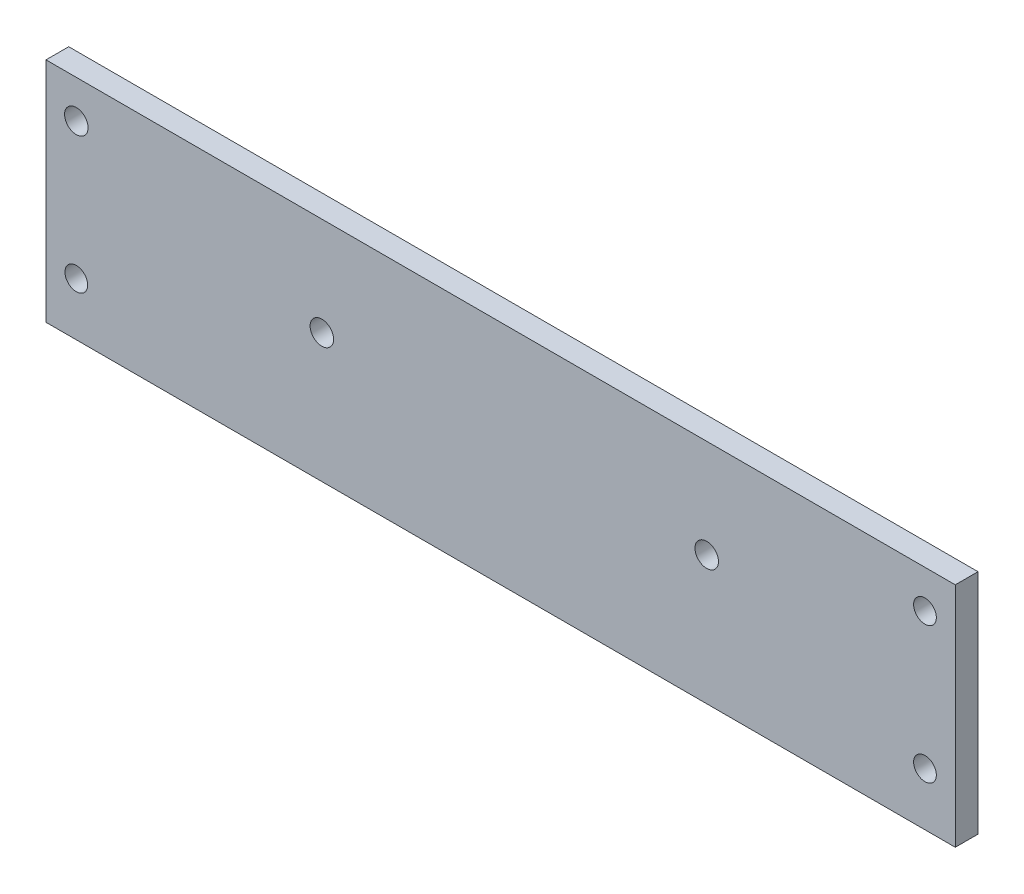
from build123d import *

# Parameters (mm, degrees)
SKETCH_1_W          = 120
SKETCH_1_H          = 30
EXTRUDE_1_DEPTH     = 3
SKETCH_3_R          = 1.5
SKETCH_3_R_2        = 1.55
CUT_EXTRUDE_2_DEPTH = 10
SKETCH_6_R          = 1.5
CUT_EXTRUDE_3_DEPTH = 10
SKETCH_8_R          = 1.55
CUT_EXTRUDE_4_DEPTH = 62.919302322


with BuildPart() as part:
    # 草图1 → 凸台-拉伸1 (new body)
    with BuildSketch(Plane.XY):
        Rectangle(SKETCH_1_W, SKETCH_1_H)
    extrude(amount=EXTRUDE_1_DEPTH)

    # 草图3 → 切除-拉伸2 (cut)
    with BuildSketch(Plane(origin=(0, 0, 0), x_dir=(-1, 0, 0), z_dir=(0, 0, -1))):
        with Locations((-56, 10)):
            Circle(SKETCH_3_R)
        with Locations((56, 10)):
            Circle(SKETCH_3_R_2)
    extrude(amount=-CUT_EXTRUDE_2_DEPTH, mode=Mode.SUBTRACT)

    # 草图6 → 切除-拉伸3 (cut)
    with BuildSketch(Plane.XY.offset(3)):
        with Locations((-56, -8)):
            Circle(SKETCH_6_R)
        with Locations((56, -8)):
            Circle(SKETCH_6_R)
    extrude(amount=-CUT_EXTRUDE_3_DEPTH, mode=Mode.SUBTRACT)

    # 草图8 → 切除-拉伸4 (cut, through all)
    with BuildSketch(Plane(origin=(0, 0, 0), x_dir=(-1, 0, 0), z_dir=(0, 0, -1))):
        with Locations((-27.196304355, 2.02)):
            Circle(SKETCH_8_R)
        with Locations((23.596304355, 2.02)):
            Circle(SKETCH_8_R)
    extrude(amount=-CUT_EXTRUDE_4_DEPTH, mode=Mode.SUBTRACT)


solid = part.part
